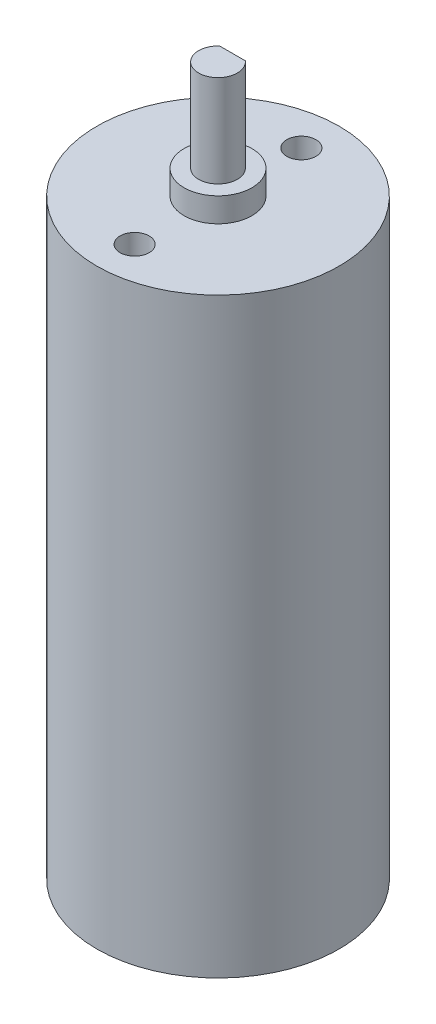
from build123d import *

# Parameters (mm, degrees)
SKETCH1_R           = 12.5
BOSS_EXTRUDE1_DEPTH = 61
SKETCH2_R           = 3.5
BOSS_EXTRUDE2_DEPTH = 2.5
SKETCH3_R           = 2
BOSS_EXTRUDE3_DEPTH = 1.5
BOSS_EXTRUDE4_DEPTH = 8
SKETCH5_R           = 1.5
CUT_EXTRUDE1_DEPTH  = 3


with BuildPart() as part:
    # Sketch1 → Boss-Extrude1 (new body)
    with BuildSketch(Plane(origin=(0, 0, 0), x_dir=(1, 0, 0), z_dir=(0, 1, 0))):
        Circle(SKETCH1_R)
    extrude(amount=BOSS_EXTRUDE1_DEPTH)

    # Sketch2 → Boss-Extrude2 (add)
    with BuildSketch(Plane(origin=(0, 61, 0), x_dir=(1, 0, 0), z_dir=(0, 1, 0))):
        Circle(SKETCH2_R)
    extrude(amount=BOSS_EXTRUDE2_DEPTH)

    # Sketch3 → Boss-Extrude3 (add)
    with BuildSketch(Plane(origin=(0, 63.5, 0), x_dir=(1, 0, 0), z_dir=(0, 1, 0))):
        Circle(SKETCH3_R)
    extrude(amount=BOSS_EXTRUDE3_DEPTH)

    # Sketch4 → Boss-Extrude4 (add)
    with BuildSketch(Plane(origin=(0, 65, 0), x_dir=(1, 0, 0), z_dir=(0, 1, 0))):
        with BuildLine():
            Line((-1.322875656, 1.5), (1.322875656, 1.5))
            ThreePointArc((1.322875656, 1.5), (0, -2), (-1.322875656, 1.5))
        make_face()
    extrude(amount=BOSS_EXTRUDE4_DEPTH)

    # Sketch5 → Cut-Extrude1 (cut)
    with BuildSketch(Plane(origin=(0, 61, 0), x_dir=(1, 0, 0), z_dir=(0, 1, 0))):
        with Locations((0, 8.6)):
            Circle(SKETCH5_R)
        with Locations((0, -8.6)):
            Circle(SKETCH5_R)
    extrude(amount=-CUT_EXTRUDE1_DEPTH, mode=Mode.SUBTRACT)


solid = part.part
